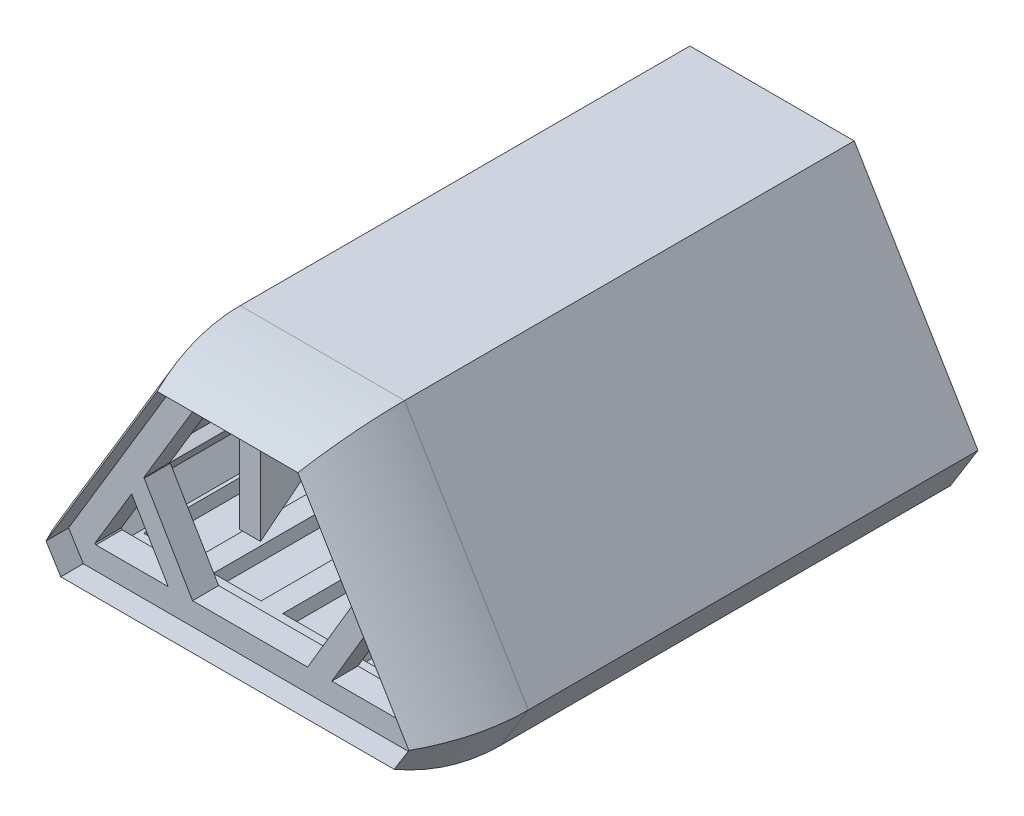
from build123d import *
from OCP.BRepFilletAPI import BRepFilletAPI_MakeChamfer

# Parameters (mm, degrees)
BOSS_EXTRUDE1_DEPTH  = 62.6
BOSS_EXTRUDE2_DEPTH  = 5.6
CUT_EXTRUDE1_DEPTH   = 2.6
CHAMFER1_SIZE        = 5
CHAMFER1_SIZE_2      = 2.6
SKETCH7_W            = 2.4
SKETCH7_H            = 11.6
BOSS_EXTRUDE3_DEPTH  = 14.6
CUT_EXTRUDE2_DEPTH   = 5.6
BOSS_EXTRUDE11_DEPTH = 3
CUT_EXTRUDE3_DEPTH   = 81
FILLET1_R            = 26
SKETCH11_W           = 5.5
SKETCH11_H           = 51
CUT_EXTRUDE4_DEPTH   = 1.6
LPATTERN1_COUNT      = 3
LPATTERN1_PITCH      = 8
LPATTERN1_COL_COUNT  = 3
LPATTERN1_COL_PITCH  = 8
SKETCH12_W           = 51
SKETCH12_H           = 4.856806487
CUT_EXTRUDE5_DEPTH   = 1.6
LPATTERN2_COUNT      = 2
LPATTERN2_PITCH      = 8
LPATTERN2_COL_COUNT  = 2
LPATTERN2_COL_PITCH  = 8
SKETCH13_W           = 51
SKETCH13_H           = 5.5
CUT_EXTRUDE6_DEPTH   = 1.6
LPATTERN3_COUNT      = 2
LPATTERN3_PITCH      = 8
LPATTERN3_COL_COUNT  = 2
LPATTERN3_COL_PITCH  = 8
SKETCH14_W           = 5.5
SKETCH14_H           = 51
CUT_EXTRUDE7_DEPTH   = 1.6
CHAMFER2_SIZE        = 1.7
CHAMFER2_SIZE2       = 2.025981107
CHAMFER3_SIZE        = 1.7
CHAMFER3_SIZE2       = 2.025981107
CHAMFER4_SIZE        = 1.7
CHAMFER4_SIZE2       = 2.025981107


# Some blends are built 0.0001 mm under size
with BuildPart() as part:
    # Sketch1 → Boss-Extrude1 (new body)
    with BuildSketch(Plane.XY):
        Polygon((-24.475616366, -10.013909772), (-21.180169245, -15.311974759), (20.041009631, -15.311974759), (23.336456752, -10.013909772), (8.987096109, 13.888025241), (-10.126255723, 13.888025241), align=None)
        Polygon((-21.428634645, -9.989877279), (-19.735463964, -12.711974759), (18.59630435, -12.711974759), (20.289475031, -9.989877279), (7.515434067, 11.288025241), (-8.654593681, 11.288025241), align=None, mode=Mode.SUBTRACT)
    extrude(amount=BOSS_EXTRUDE1_DEPTH)

    # Sketch2 → Boss-Extrude2 (add)
    with BuildSketch(Plane.XY.offset(62.6)):
        Polygon((-8.654593681, 11.288025241), (-21.428634645, -9.989877279), (-19.735463964, -12.711974759), (18.59630435, -12.711974759), (20.289475031, -9.989877279), (7.515434067, 11.288025241), align=None)
        Polygon((-7.182931639, 8.688025241), (-18.381652924, -9.965844785), (-18.290758683, -10.111974759), (17.151599069, -10.111974759), (17.24249331, -9.965844785), (6.043772025, 8.688025241), align=None, mode=Mode.SUBTRACT)
    extrude(amount=-BOSS_EXTRUDE2_DEPTH)

    # Sketch4 → Cut-Extrude1 (cut)
    with BuildSketch(Plane.XY.offset(62.6)):
        Polygon((7.515434067, 11.288025241), (-8.654593681, 11.288025241), (-21.428634645, -9.989877279), (-19.735463964, -12.711974759), (18.59630435, -12.711974759), (20.289475031, -9.989877279), align=None)
        Polygon((6.043772025, 8.688025241), (-7.182931639, 8.688025241), (-18.381652924, -9.965844785), (-18.290758683, -10.111974759), (17.151599069, -10.111974759), (17.24249331, -9.965844785), align=None, mode=Mode.SUBTRACT)
    extrude(amount=-CUT_EXTRUDE1_DEPTH, mode=Mode.SUBTRACT)

    # Chamfer1
    chamfer1_edges_1 = [part.edges().sort_by_distance(p)[0] for p in [
        (-0.569579807, -15.311974759, 62.6),
    ]]
    chamfer1_side_1 = [part.faces().sort_by_distance(p)[0] for p in [
        (-0.569579807, -15.311974759, 62.548),
    ]]
    chamfer1_edges_2 = [part.edges().sort_by_distance(p)[0] for p in [
        (21.688733191, -12.662942265, 62.6),
    ]]
    chamfer1_side_2 = [part.faces().sort_by_distance(p)[0] for p in [
        (21.644578037, -12.635477337, 62.6),
    ]]
    chamfer1_edges_3 = [part.edges().sort_by_distance(p)[0] for p in [
        (16.16177643, 1.937057735, 62.6),
    ]]
    chamfer1_side_3 = [part.faces().sort_by_distance(p)[0] for p in [
        (16.117193547, 1.91029271, 62.6),
    ]]
    chamfer1_edges_4 = [part.edges().sort_by_distance(p)[0] for p in [
        (-0.569579807, 13.888025241, 62.6),
    ]]
    chamfer1_side_4 = [part.faces().sort_by_distance(p)[0] for p in [
        (-0.569579807, 13.836025241, 62.6),
    ]]
    chamfer1_edges_5 = [part.edges().sort_by_distance(p)[0] for p in [
        (-17.300936044, 1.937057735, 62.6),
    ]]
    chamfer1_side_5 = [part.faces().sort_by_distance(p)[0] for p in [
        (-17.300936044, 1.937057735, 62.548),
    ]]
    chamfer1_edges_6 = [part.edges().sort_by_distance(p)[0] for p in [
        (-22.827892805, -12.662942265, 62.6),
    ]]
    chamfer1_side_6 = [part.faces().sort_by_distance(p)[0] for p in [
        (-22.827892805, -12.662942265, 62.548),
    ]]
    chamfer1 = BRepFilletAPI_MakeChamfer(part.part.solid().wrapped)
    for e in chamfer1_edges_1:
        chamfer1.Add(CHAMFER1_SIZE - 0.0001, CHAMFER1_SIZE_2 - 0.0001, e.wrapped, chamfer1_side_1[0].wrapped)
    for e in chamfer1_edges_2:
        chamfer1.Add(CHAMFER1_SIZE_2 - 0.0001, CHAMFER1_SIZE - 0.0001, e.wrapped, chamfer1_side_2[0].wrapped)
    for e in chamfer1_edges_3:
        chamfer1.Add(CHAMFER1_SIZE_2 - 0.0001, CHAMFER1_SIZE - 0.0001, e.wrapped, chamfer1_side_3[0].wrapped)
    for e in chamfer1_edges_4:
        chamfer1.Add(CHAMFER1_SIZE_2 - 0.0001, CHAMFER1_SIZE - 0.0001, e.wrapped, chamfer1_side_4[0].wrapped)
    for e in chamfer1_edges_5:
        chamfer1.Add(CHAMFER1_SIZE - 0.0001, CHAMFER1_SIZE_2 - 0.0001, e.wrapped, chamfer1_side_5[0].wrapped)
    for e in chamfer1_edges_6:
        chamfer1.Add(CHAMFER1_SIZE - 0.0001, CHAMFER1_SIZE_2 - 0.0001, e.wrapped, chamfer1_side_6[0].wrapped)
    add(Compound.cast(chamfer1.Shape()), mode=Mode.REPLACE)  # a hair under: the kernel refuses the full size

    # Sketch7 → Boss-Extrude3 (add)
    with BuildSketch(Plane.XY.offset(60)):
        with Locations((-0.569579807, 5.488025241)):
            Rectangle(SKETCH7_W, SKETCH7_H)
    extrude(amount=-BOSS_EXTRUDE3_DEPTH)

    # Sketch8 → Cut-Extrude2 (cut)
    with BuildSketch(Plane(origin=(0.630420193, 0, 0), x_dir=(0, 0, -1), z_dir=(1, 0, 0))):
        Polygon((-45.4, -0.311974759), (-45.4, 11.288025241), (-60, -0.311974759), align=None)
    extrude(amount=-CUT_EXTRUDE2_DEPTH, mode=Mode.SUBTRACT)

    # Sketch9 → Boss-Extrude11 (add)
    with BuildSketch(Plane.XY.offset(60)):
        Polygon((13.046908424, -2.977199103), (8.831384276, -10.111974759), (9.211067566, -10.75458882), (5.807424218, -10.75458882), (6.043772025, -10.111974759), (11.643132668, -0.638909772), (11.902294033, -0.497125706), (13.714637927, -2.3094696), align=None)
        Polygon((-14.186068038, -2.977199103), (-14.822440578, -2.585111628), (-13.347627203, -0.191434724), (-12.736845161, -0.711974759), (-7.182931639, -10.111974759), (-6.628519955, -10.75458882), (-9.97054389, -10.75458882), (-9.97054389, -10.111974759), align=None)
    extrude(amount=-BOSS_EXTRUDE11_DEPTH)

    # Sketch10 → Cut-Extrude3 (cut)
    with BuildSketch(Plane(origin=(0, 0, 0), x_dir=(-1, 0, 0), z_dir=(0, 0, -1))):
        Polygon((24.475616366, -10.013909772), (10.126255723, 13.888025241), (-8.987096109, 13.888025241), (-23.336456752, -10.013909772), (-20.041009631, -15.311974759), (21.180169245, -15.311974759), align=None)
        Polygon((24.241233156, -10.012061119), (10.013050951, 13.688025241), (-8.873891337, 13.688025241), (-23.102073542, -10.012061119), (-19.929878455, -15.111974759), (21.069038069, -15.111974759), align=None, mode=Mode.SUBTRACT)
    extrude(amount=-CUT_EXTRUDE3_DEPTH, mode=Mode.SUBTRACT)

    # Fillet1
    # the kernel refuses this fillet: 26 mm, written as the material it takes off along each edge
    with BuildSketch(Plane(origin=(31.414243832, 3.351351117, 57.984722485), x_dir=(-0.39174625811116504, 0.24366992131316473, 0.8872202875854094), z_dir=(-0.5281717070926119, -0.8491375906335064, 0))) as fillet1_piece_1:
        with BuildLine():
            CenterArc((6.409899399, 25.971924525), FILLET1_R, 242.52600135, 24.811106356)
            Line((-5.585097434, 2.904197048), (-5.824997371, 2.442842498))
            Line((-5.824997371, 2.442842498), (-0.239899937, -0.46135455))
            Line((-0.239899937, -0.46135455), (0, -0.52))
            ThreePointArc((0, -0.52), (2.600976093, -0.52), (5.177793242, -0.51943849))
            Line((5.177793242, -0.51943849), (5.201952186, 0))
        make_face()
    extrude(amount=37.481249755, mode=Mode.SUBTRACT)
    with BuildSketch(Plane(origin=(-36.806666909, -15.111974759, 57.984722485), x_dir=(0, 0.46134603205930286, 0.8872202875854095), z_dir=(1, 0, 0))) as fillet1_piece_2:
        with BuildLine():
            CenterArc((6.409899399, -25.971924525), FILLET1_R, 92.662892294, 24.811106356)
            Line((-5.585097434, -2.904197048), (-5.824997371, -2.442842498))
            Line((-5.824997371, -2.442842498), (-0.239899937, 0.46135455))
            Line((-0.239899937, 0.46135455), (0, 0.52))
            ThreePointArc((0, 0.52), (2.600976093, 0.52), (5.177793242, 0.51943849))
            Line((5.177793242, 0.51943849), (5.201952186, 0))
        make_face()
    extrude(amount=72.474174205, mode=Mode.SUBTRACT)
    with BuildSketch(Plane(origin=(-32.553403446, 3.351351117, 57.984722485), x_dir=(0.39174625811116337, 0.24366992131316362, 0.8872202875854104), z_dir=(0.5281717070926113, -0.8491375906335067, 0))) as fillet1_piece_3:
        with BuildLine():
            CenterArc((6.409899399, -25.971924525), FILLET1_R, 92.662892294, 24.811106356)
            Line((-5.585097434, -2.904197048), (-5.824997371, -2.442842498))
            Line((-5.824997371, -2.442842498), (-0.239899937, 0.46135455))
            Line((-0.239899937, 0.46135455), (0, 0.52))
            ThreePointArc((0, 0.52), (2.600976093, 0.52), (5.177793242, 0.51943849))
            Line((5.177793242, 0.51943849), (5.201952186, 0))
        make_face()
    extrude(amount=37.481249755, mode=Mode.SUBTRACT)
    with BuildSketch(Plane(origin=(-1.912704463, 27.180888106, 57.984722485), x_dir=(0.39554108226314943, -0.2374603409813078, 0.8872202875854099), z_dir=(-0.5147120046125904, -0.8573631391118287, 0))) as fillet1_piece_4:
        with BuildLine():
            CenterArc((6.409899399, -25.971924525), FILLET1_R, 92.662892294, 24.811106356)
            Line((-5.585097434, -2.904197048), (-5.824997371, -2.442842498))
            Line((-5.824997371, -2.442842498), (-0.239899937, 0.46135455))
            Line((-0.239899937, 0.46135455), (0, 0.52))
            ThreePointArc((0, 0.52), (2.600976093, 0.52), (5.177793242, 0.51943849))
            Line((5.177793242, 0.51943849), (5.201952186, 0))
        make_face()
    extrude(amount=59.118254304, mode=Mode.SUBTRACT)
    with BuildSketch(Plane(origin=(-25.750679791, 13.688025241, 57.984722485), x_dir=(0, -0.4613460320593018, 0.88722028758541), z_dir=(1, 0, 0))) as fillet1_piece_5:
        with BuildLine():
            CenterArc((6.409899399, 25.971924525), FILLET1_R, 242.52600135, 24.811106356)
            Line((-5.585097434, 2.904197048), (-5.824997371, 2.442842498))
            Line((-5.824997371, 2.442842498), (-0.239899937, -0.46135455))
            Line((-0.239899937, -0.46135455), (0, -0.52))
            ThreePointArc((0, -0.52), (2.600976093, -0.52), (5.177793242, -0.51943849))
            Line((5.177793242, -0.51943849), (5.201952186, 0))
        make_face()
    extrude(amount=50.362199967, mode=Mode.SUBTRACT)
    with BuildSketch(Plane(origin=(0.773544849, 27.180888106, 57.984722485), x_dir=(-0.3955410822631513, -0.23746034098130891, 0.8872202875854089), z_dir=(0.5147120046125901, -0.8573631391118287, 0))) as fillet1_piece_6:
        with BuildLine():
            CenterArc((6.409899399, 25.971924525), FILLET1_R, 242.52600135, 24.811106356)
            Line((-5.585097434, 2.904197048), (-5.824997371, 2.442842498))
            Line((-5.824997371, 2.442842498), (-0.239899937, -0.46135455))
            Line((-0.239899937, -0.46135455), (0, -0.52))
            ThreePointArc((0, -0.52), (2.600976093, -0.52), (5.177793242, -0.51943849))
            Line((5.177793242, -0.51943849), (5.201952186, 0))
        make_face()
    extrude(amount=59.118254304, mode=Mode.SUBTRACT)

    # Sketch11 → Cut-Extrude4 (cut)
    with BuildSketch(Plane(origin=(0, -12.711974759, 0), x_dir=(1, 0, 0), z_dir=(0, 1, 0))):
        with Locations((-0.569579807, -27.99093939)):
            Rectangle(SKETCH11_W, SKETCH11_H)
    cut_extrude4 = extrude(amount=-CUT_EXTRUDE4_DEPTH, mode=Mode.SUBTRACT)

    # LPattern1: Cut-Extrude4 ×3
    with Locations(*[(i * LPATTERN1_PITCH, 0, 0) for i in range(1, LPATTERN1_COUNT)]):
        add(cut_extrude4, mode=Mode.SUBTRACT)

    # LPattern1 col: Cut-Extrude4 ×3
    with Locations(*[(-i * LPATTERN1_COL_PITCH, 0, 0) for i in range(1, LPATTERN1_COL_COUNT)]):
        add(cut_extrude4, mode=Mode.SUBTRACT)

    # Sketch12 → Cut-Extrude5 (cut)
    with BuildSketch(Plane(origin=(-11.34309584, 6.809748789, 0), x_dir=(0, 0, -1), z_dir=(0.8573631391118286, -0.5147120046125905, 0))):
        with Locations((-27.99093939, -7.185607273)):
            Rectangle(SKETCH12_W, SKETCH12_H)
    cut_extrude5 = extrude(amount=-CUT_EXTRUDE5_DEPTH, mode=Mode.SUBTRACT)

    # LPattern2: Cut-Extrude5 ×2
    with Locations(*[Vector(-0.5147120046125904, -0.8573631391118286, 0) * (i * LPATTERN2_PITCH) for i in range(1, LPATTERN2_COUNT)]):
        add(cut_extrude5, mode=Mode.SUBTRACT)

    # LPattern2 col: Cut-Extrude5 ×2
    with Locations(*[Vector(0.5147120046125906, 0.8573631391118286, 0) * (i * LPATTERN2_COL_PITCH) for i in range(1, LPATTERN2_COL_COUNT)]):
        add(cut_extrude5, mode=Mode.SUBTRACT)

    # Sketch13 → Cut-Extrude6 (cut)
    with BuildSketch(Plane(origin=(10.505732014, 6.307043233, 0), x_dir=(0, 0, 1), z_dir=(-0.8573631391118287, -0.5147120046125901, 0))):
        with Locations((27.99093939, -6.599268144)):
            Rectangle(SKETCH13_W, SKETCH13_H)
    cut_extrude6 = extrude(amount=-CUT_EXTRUDE6_DEPTH, mode=Mode.SUBTRACT)

    # LPattern3: Cut-Extrude6 ×2
    with Locations(*[Vector(0.5147120046125901, -0.8573631391118288, 0) * (i * LPATTERN3_PITCH) for i in range(1, LPATTERN3_COUNT)]):
        add(cut_extrude6, mode=Mode.SUBTRACT)

    # LPattern3 col: Cut-Extrude6 ×2
    with Locations(*[Vector(-0.5147120046125901, 0.8573631391118288, 0) * (i * LPATTERN3_COL_PITCH) for i in range(1, LPATTERN3_COL_COUNT)]):
        add(cut_extrude6, mode=Mode.SUBTRACT)

    # Sketch14 → Cut-Extrude7 (cut)
    with BuildSketch(Plane.XZ.offset(-11.288025241)):
        with Locations((4.130420193, 28.049435943)):
            Rectangle(SKETCH14_W, SKETCH14_H)
        with Locations((-5.310377128, 28.061535376)):
            Rectangle(SKETCH14_W, SKETCH14_H)
    extrude(amount=-CUT_EXTRUDE7_DEPTH, mode=Mode.SUBTRACT)

    # Chamfer2
    chamfer2_edges = [part.edges().sort_by_distance(p)[0] for p in [
        (-0.569579807, -12.711974759, 57),
    ]]
    chamfer2_side = [part.faces().sort_by_distance(p)[0] for p in [
        (-2.250869811, 9.988025241, 57),
    ]]
    chamfer(chamfer2_edges, length=CHAMFER2_SIZE, length2=CHAMFER2_SIZE2, reference=chamfer2_side[0])

    # Chamfer3
    chamfer3_edges = [part.edges().sort_by_distance(p)[0] for p in [
        (-15.041614163, 0.649073981, 57),
    ]]
    chamfer3_side = [part.faces().sort_by_distance(p)[0] for p in [
        (-20.709079395, -10.251078432, 57),
    ]]
    chamfer(chamfer3_edges, length=CHAMFER3_SIZE, length2=CHAMFER3_SIZE2, reference=chamfer3_side[0])

    # Chamfer4
    chamfer4_edges = [part.edges().sort_by_distance(p)[0] for p in [
        (13.902454549, 0.649073981, 57),
    ]]
    chamfer4_side = [part.faces().sort_by_distance(p)[0] for p in [
        (-0.202849696, -10.550962467, 57),
    ]]
    chamfer(chamfer4_edges, length=CHAMFER4_SIZE, length2=CHAMFER4_SIZE2, reference=chamfer4_side[0])


solid = part.part
